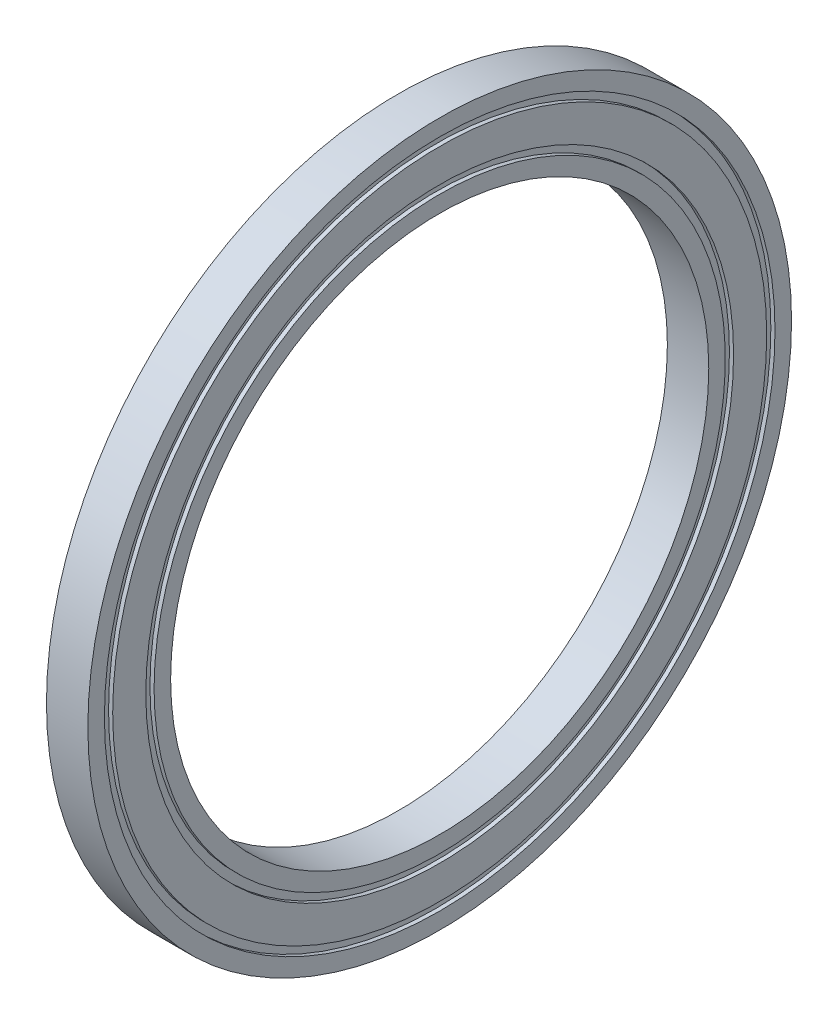
from build123d import *


with BuildPart() as part:
    # Sketch1 → Revolve1 (revolve)
    with BuildSketch(Plane.XY):
        Polygon((-2.5, 42.5), (2.5, 42.5), (2.5, 40.5), (2, 40.5), (2, 39.5), (2.5, 39.5), (2.5, 35.5), (2, 35.5), (2, 34.5), (2.5, 34.5), (2.5, 32.5), (-2.5, 32.5), (-2.5, 34.5), (-2, 34.5), (-2, 35.5), (-2.5, 35.5), (-2.5, 39.5), (-2, 39.5), (-2, 40.5), (-2.5, 40.5), align=None)
    revolve(axis=Axis((0, 0, 0), (1, 0, 0)))


solid = part.part
